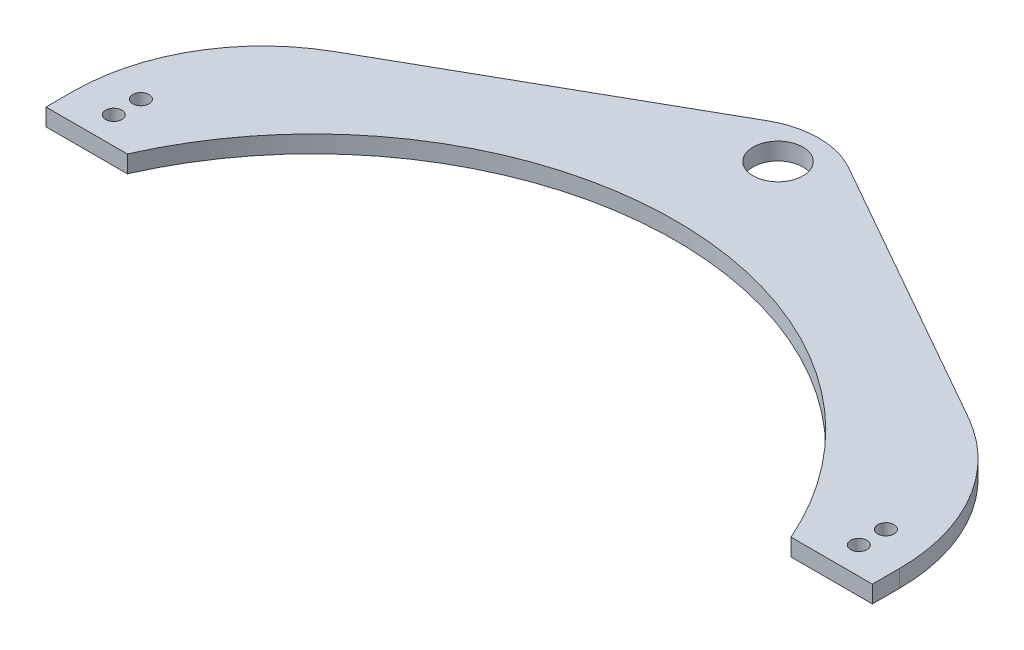
from build123d import *

# Parameters (mm, degrees)
SKETCH1_R           = 4.6
SKETCH1_R_2         = 1.5
BOSS_EXTRUDE2_DEPTH = 3.175


with BuildPart() as part:
    # Sketch1 → Boss-Extrude2 (new body)
    with BuildSketch(Plane(origin=(0, 0, 0), x_dir=(1, 0, 0), z_dir=(0, 1, 0))):
        with BuildLine():
            Line((-7.5, 0), (0, 0))
            ThreePointArc((0, 0), (61.2, 39.907584028), (122.4, 0))
            Line((122.4, 0), (129.9, 0))
            Line((129.9, 0), (137.4, 0))
            Line((137.4, 0), (137.4, 5.001196831))
            ThreePointArc((137.4, 5.001196831), (132.638976527, 22.625166265), (119.651182936, 35.45438529))
            Line((119.651182936, 35.45438529), (68.639886063, 64.351366482))
            ThreePointArc((68.639886063, 64.351366482), (65.069446402, 65.804662996), (61.246521948, 66.3))
            Line((61.246521948, 66.3), (61.153478052, 66.3))
            ThreePointArc((61.153478052, 66.3), (57.330553598, 65.804662996), (53.760113937, 64.351366482))
            Line((53.760113937, 64.351366482), (2.748817064, 35.45438529))
            ThreePointArc((2.748817064, 35.45438529), (-10.238976527, 22.625166265), (-15, 5.001196831))
            Line((-15, 5.001196831), (-15, 0))
            Line((-15, 0), (-7.5, 0))
        make_face()
        with Locations((61.2, 58.8)):
            Circle(SKETCH1_R, mode=Mode.SUBTRACT)
        with BuildLine():
            ThreePointArc((-7.5, 3.5), (-9, 5), (-7.5, 6.5))
            ThreePointArc((-7.5, 6.5), (-6, 5), (-7.5, 3.5))
        make_face(mode=Mode.SUBTRACT)
        with Locations((-7.5, 10)):
            Circle(SKETCH1_R_2, mode=Mode.SUBTRACT)
        with BuildLine():
            ThreePointArc((129.9, 3.5), (128.4, 5), (129.9, 6.5))
            ThreePointArc((129.9, 6.5), (131.4, 5), (129.9, 3.5))
        make_face(mode=Mode.SUBTRACT)
        with Locations((129.9, 10)):
            Circle(SKETCH1_R_2, mode=Mode.SUBTRACT)
    extrude(amount=BOSS_EXTRUDE2_DEPTH)


solid = part.part
